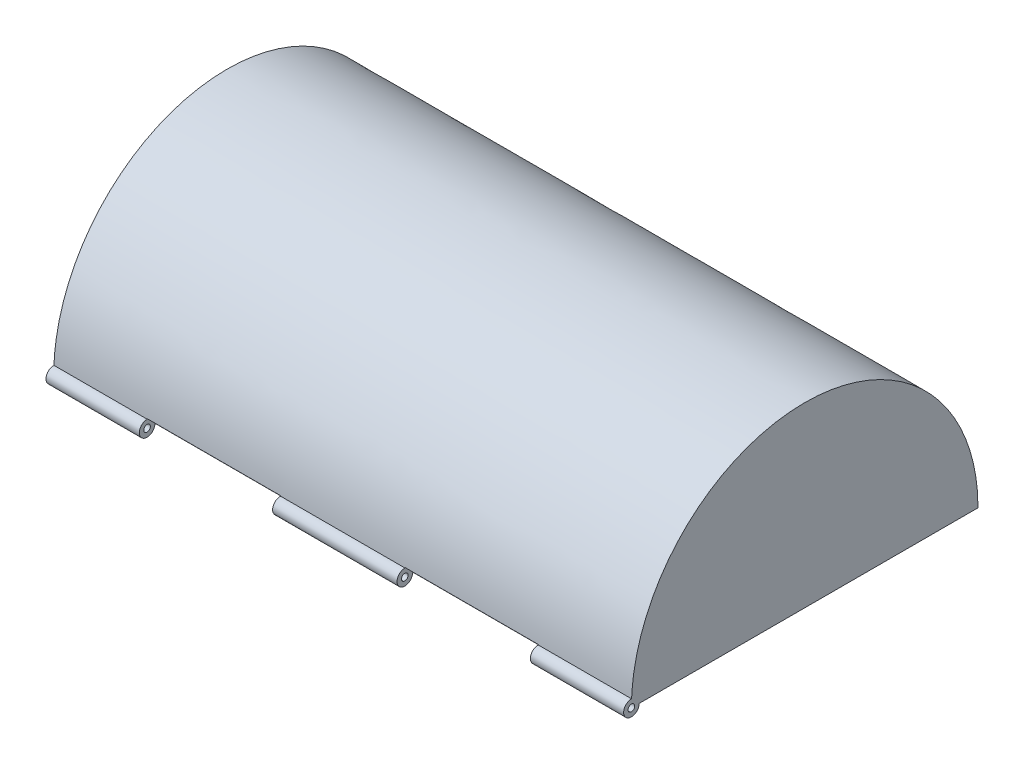
from build123d import *

# Parameters (mm, degrees)
EXTRUDE_1_DEPTH         = 130
SHELL_START             = 3
SHELL_1_DEPTH           = 124
SKETCH_2_R              = 1.75
EXTRUDE_2_DEPTH         = 130
SKETCH_2_3_R            = 0.75
CUT_EXTRUDE_1_DEPTH     = 142.987895759
CUT_EXTRUDE_START       = 21
SKETCH_2_6_R            = 1.85
CUT_EXTRUDE_4_DEPTH     = 30
CUT_EXTRUDE_START_2     = 79
CUT_EXTRUDE_5_OUTLINE_R = 0.75
CUT_EXTRUDE_5_DEPTH     = 30
SKETCH_3_W              = 10
SKETCH_3_H              = 15
EXTRUDE_4_DEPTH         = 2
SKETCH_4_R              = 1.5
CUT_EXTRUDE_6_DEPTH     = 142.987895759


with BuildPart() as part:
    # 草图1 → 凸台-拉伸1 (new body)
    with BuildSketch(Plane(origin=(0, 0, 0), x_dir=(0, 0, -1), z_dir=(1, 0, 0))):
        with BuildLine():
            add(Edge.make_bspline(
                [(0, 40), (-39, 40), (-39, 0)],
                knots=[0, 0, 0, 1.570796327, 1.570796327, 1.570796327], degree=2, weights=[1, 0.707106781, 1]))
            Line((-39, 0), (39, 0))
            add(Edge.make_bspline(
                [(39, 0), (39, 40), (0, 40)],
                knots=[4.71238898, 4.71238898, 4.71238898, 6.283185307, 6.283185307, 6.283185307], degree=2, weights=[1, 0.707106781, 1]))
        make_face()
    extrude(amount=EXTRUDE_1_DEPTH)

    # 抽壳1: read off the stored shape, not the designer's step
    # 抽壳1 outline → 抽壳1 (cut)
    with BuildSketch(Plane.YZ.offset(SHELL_START)):
        with BuildLine():
            Line((0, 36), (0, -36))
            add(Edge.make_bspline(
                [(0, -36), (0.708298707, -36.000018391), (1.416596353, -35.980210573), (2.830986248, -35.901074526), (3.53707848, -35.841745978), (4.944844291, -35.683700318), (5.646517861, -35.584983121), (7.043313984, -35.348412698), (7.738435805, -35.210555147), (9.119850145, -34.896067231), (9.806142858, -34.719437717), (11.167671814, -34.327898395), (11.842908122, -34.112988812), (13.515296226, -33.528270197), (14.504283388, -33.134792125), (16.445182773, -32.265248637), (17.397094484, -31.789182078), (19.256424367, -30.757635939), (20.163859997, -30.202187858), (21.927620254, -29.015342978), (22.783945784, -28.383947524), (24.427762868, -27.058265606), (25.216017058, -26.364924894), (26.729988944, -24.913007213), (27.455706864, -24.154430479), (28.838774335, -22.577199995), (29.496118771, -21.758541759), (30.736896266, -20.067004917), (31.320330934, -19.194127492), (32.393990097, -17.424131246), (32.886263381, -16.528254766), (33.791946294, -14.697481794), (34.205357213, -13.762585942), (34.949751362, -11.860727731), (35.280749957, -10.893771389), (35.857568273, -8.934776078), (36.103389296, -7.942737493), (36.50283156, -5.965194226), (36.658534508, -4.980109531), (36.885482896, -3.000265559), (36.956729818, -2.005506452), (37.014165622, -0.013589181), (37.00035893, 0.983568856), (36.887814528, 2.973079183), (36.789077068, 3.965431487), (36.509061797, 5.927225436), (36.328707422, 6.896799068), (35.887229364, 8.817365627), (35.626106502, 9.768358743), (35.025206241, 11.645150066), (34.685428983, 12.570948317), (33.929930247, 14.391016359), (33.514208126, 15.285285882), (32.607054534, 17.042141524), (32.115135356, 17.904475768), (31.061468956, 19.585355288), (30.499721605, 20.403900481), (29.310666122, 21.991899142), (28.683357255, 22.761352059), (27.367843762, 24.246297716), (26.679638341, 24.961789752), (25.23229793, 26.348798562), (24.471979441, 27.019080761), (22.898676654, 28.294630669), (22.085691359, 28.899897148), (20.412401728, 30.042058841), (19.552077616, 30.578925168), (18.231214505, 31.330166229), (17.785847736, 31.571577737), (16.885558725, 32.0361575), (16.43063417, 32.259321277), (15.028113545, 32.912358203), (14.066397258, 33.312315439), (12.11312954, 34.031181876), (11.121577593, 34.350089677), (9.617811691, 34.766113617), (9.114026098, 34.894358918), (8.101692335, 35.129981141), (7.593145313, 35.237362968), (6.572251661, 35.431095806), (6.05990642, 35.517454154), (5.032108381, 35.66907095), (4.516655571, 35.734329321), (3.335314016, 35.859328829), (2.668679155, 35.912119631), (1.334685227, 35.982433965), (0.667329302, 36.000017106), (0, 36)],
                knots=[0, 0, 0, 0, 2.124617772, 2.124617772, 4.249252659, 4.249252659, 6.373892063, 6.373892063, 8.498766252, 8.498766252, 10.623593724, 10.623593724, 12.748408692, 12.748408692, 15.937512092, 15.937512092, 19.126659602, 19.126659602, 22.314545112, 22.314545112, 25.50237418, 25.50237418, 28.647900593, 28.647900593, 31.793415743, 31.793415743, 34.939166048, 34.939166048, 38.084847834, 38.084847834, 41.147751959, 41.147751959, 44.210605954, 44.210605954, 47.272888401, 47.272888401, 50.335123934, 50.335123934, 53.323465502, 53.323465502, 56.311754642, 56.311754642, 59.299888308, 59.299888308, 62.288013205, 62.288013205, 65.243143661, 65.243143661, 68.198244091, 68.198244091, 71.15333926, 71.15333926, 74.108459485, 74.108459485, 77.083341844, 77.083341844, 80.058229713, 80.058229713, 83.033150929, 83.033150929, 86.008110937, 86.008110937, 89.045366642, 89.045366642, 92.08267986, 92.08267986, 95.121271643, 95.121271643, 96.640674695, 96.640674695, 98.160449561, 98.160449561, 101.281325644, 101.281325644, 104.402255618, 104.402255618, 105.961445912, 105.961445912, 107.520269119, 107.520269119, 109.078547566, 109.078547566, 110.636831839, 110.636831839, 112.642039889, 112.642039889, 114.643850131, 114.643850131, 114.643850131, 114.643850131], degree=3))
        make_face()
    extrude(amount=SHELL_1_DEPTH, mode=Mode.SUBTRACT)

    # 草图2 → 凸台-拉伸2 (add, through all)
    with BuildSketch(Plane(origin=(0, 0, 0), x_dir=(0, 0, -1), z_dir=(1, 0, 0))):
        with Locations((-39, 0)):
            Circle(SKETCH_2_R)
    extrude(amount=EXTRUDE_2_DEPTH)

    # 草图2<3> → 切除-拉伸1 (cut, through all)
    with BuildSketch(Plane(origin=(0, 0, 0), x_dir=(0, 0, -1), z_dir=(1, 0, 0))):
        with Locations((-39, 0)):
            Circle(SKETCH_2_3_R)
    extrude(amount=CUT_EXTRUDE_1_DEPTH, mode=Mode.SUBTRACT)

    # 草图2<6> → 切除-拉伸4 (cut)
    with BuildSketch(Plane(origin=(0, 0, 0), x_dir=(0, 0, -1), z_dir=(1, 0, 0)).offset(CUT_EXTRUDE_START)):
        with Locations((-39, 0)):
            Circle(SKETCH_2_6_R)
    extrude(amount=CUT_EXTRUDE_4_DEPTH, mode=Mode.SUBTRACT)

    # 切除-拉伸5: read off the stored shape, not the designer's step
    # 切除-拉伸5 outline → 切除-拉伸5 (cut)
    with BuildSketch(Plane(origin=(0, 0, 0), x_dir=(0, 0, -1), z_dir=(1, 0, 0)).offset(CUT_EXTRUDE_START_2)):
        with BuildLine():
            Line((-37.25, 0), (-37.15, 0))
            ThreePointArc((-37.15, 0), (-37.677186952, 1.293315755), (-38.95828718, 1.849529681))
            add(Edge.make_bspline(
                [(-38.95828718, 1.849529681), (-38.960541951, 1.799568608), (-38.962674899, 1.749601908)],
                knots=[7.807459654, 7.807459654, 7.807459654, 7.810227627, 7.810227627, 7.810227627], degree=2, weights=[0.998982493, 0.999490336, 1]))
            ThreePointArc((-38.962674899, 1.749601908), (-40.250563658, -1.224169325), (-37.25, 0))
        make_face()
        with Locations((-39, 0)):
            Circle(CUT_EXTRUDE_5_OUTLINE_R, mode=Mode.SUBTRACT)
    extrude(amount=CUT_EXTRUDE_5_DEPTH, mode=Mode.SUBTRACT)

    # 草图3 → 凸台-拉伸4 (add)
    with BuildSketch(Plane.XZ):
        with Locations((5, 28.5)):
            Rectangle(SKETCH_3_W, SKETCH_3_H)
        with Locations((125, 28.5)):
            Rectangle(SKETCH_3_W, SKETCH_3_H)
    extrude(amount=-EXTRUDE_4_DEPTH)

    # 草图4 → 切除-拉伸6 (cut, through all)
    with BuildSketch(Plane.XY):
        with Locations((99, 15)):
            Circle(SKETCH_4_R)
        with Locations((31, 14)):
            Circle(SKETCH_4_R)
        with Locations((96.5, 19.330127019)):
            Circle(SKETCH_4_R)
        with Locations((94, 15)):
            Circle(SKETCH_4_R)
        with Locations((33.5, 18.330127019)):
            Circle(SKETCH_4_R)
        with Locations((36, 14)):
            Circle(SKETCH_4_R)
    extrude(amount=-CUT_EXTRUDE_6_DEPTH, mode=Mode.SUBTRACT)


solid = part.part
